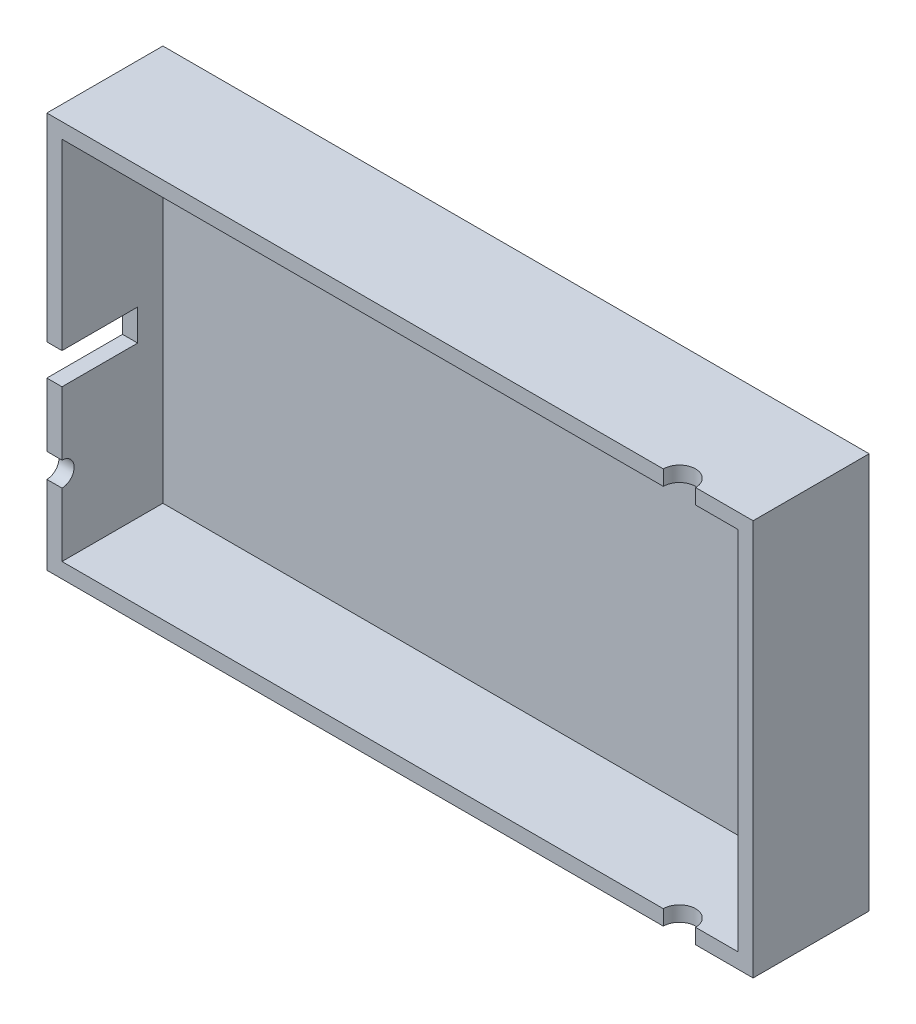
from build123d import *

# Parameters (mm, degrees)
SKETCH_1_W          = 70
SKETCH_1_H          = 39.25
EXTRUDE_1_DEPTH     = 11.5
SHELL_1_T           = -1.5
SKETCH_4_R          = 1.6
F_3MM_2_DEPTH       = 58.208500243
SKETCH_10_R         = 1.2
CUT_EXTRUDE_3_DEPTH = 40
CUT_EXTRUDE_4_REACH = 77.553
SKETCH_11_W         = 7.5
SKETCH_11_H         = 3.1


with BuildPart() as part:
    # 草图1 → 凸台-拉伸1 (new body)
    with BuildSketch(Plane.XY):
        with Locations((-5, -6.375)):
            Rectangle(SKETCH_1_W, SKETCH_1_H)
    extrude(amount=EXTRUDE_1_DEPTH)

    # 抽壳1
    shell_1_openings = [part.faces().sort_by_distance(p)[0] for p in [
        (-5, -6.375, 11.5),
    ]]
    offset(amount=SHELL_1_T, openings=shell_1_openings, kind=Kind.INTERSECTION)

    # 草图4 → 3MM孔切除-拉伸2 (cut, through all)
    with BuildSketch(Plane.XZ.offset(26)):
        with Locations((22.7, 11.5)):
            Circle(SKETCH_4_R)
    extrude(amount=-F_3MM_2_DEPTH, mode=Mode.SUBTRACT)

    # 草图10 → 切除-拉伸3 (cut)
    with BuildSketch(Plane.ZY.offset(40)):
        with Locations((11.5, -17)):
            Circle(SKETCH_10_R)
    extrude(amount=-CUT_EXTRUDE_3_DEPTH, mode=Mode.SUBTRACT)

    # 草图11 → 切除-拉伸4 (cut, up to next)
    with BuildSketch(Plane.ZY.offset(40), mode=Mode.PRIVATE) as cut_extrude_4_sk1:
        with Locations((7.75, -7.95)):
            Rectangle(SKETCH_11_W, SKETCH_11_H)
    cut_extrude_4_tool1 = extrude(cut_extrude_4_sk1.sketch, amount=-CUT_EXTRUDE_4_REACH, mode=Mode.PRIVATE) & part.part
    add(cut_extrude_4_tool1.solids().sort_by_distance((-40, -7.95, 7.75))[0], mode=Mode.SUBTRACT)


solid = part.part
